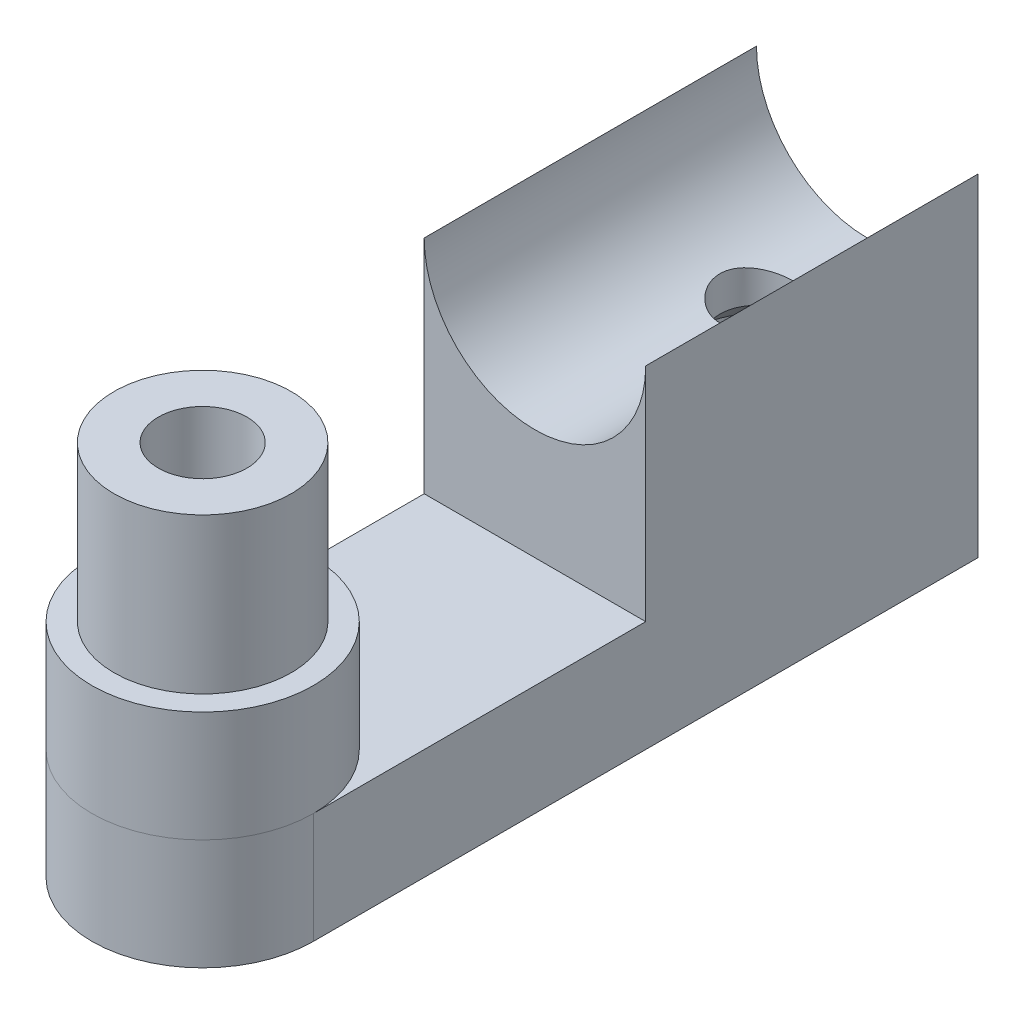
from build123d import *

# Parameters (mm, degrees)
SKETCH2_R           = 4
BOSS_EXTRUDE1_DEPTH = 7
SKETCH3_R           = 5
BOSS_EXTRUDE2_DEPTH = 5
SKETCH4_R           = 1.65
CUT_EXTRUDE1_DEPTH  = 12
SKETCH5_R           = 2
CUT_EXTRUDE2_DEPTH  = 5
BOSS_EXTRUDE3_DEPTH = 5
SKETCH8_W           = 10
SKETCH8_H           = 15
BOSS_EXTRUDE4_DEPTH = 10
CUT_EXTRUDE3_DEPTH  = 15
SKETCH10_R          = 2.75
CUT_EXTRUDE4_DEPTH  = 7.5
SKETCH11_R          = 1.65
CUT_EXTRUDE5_DEPTH  = 32.862987933
CHAMFER2_SIZE       = 1.2


with BuildPart() as part:
    # Sketch2 → Boss-Extrude1 (new body)
    with BuildSketch(Plane(origin=(0, 0, 0), x_dir=(1, 0, 0), z_dir=(0, 1, 0))):
        with Locations(Location((0, 0, 0), (0, 0, 270))):
            Circle(SKETCH2_R)
    extrude(amount=BOSS_EXTRUDE1_DEPTH)

    # Sketch3 → Boss-Extrude2 (add)
    with BuildSketch(Plane.XZ):
        with Locations(Location((0, 0, 0), (0, 0, 270))):
            Circle(SKETCH3_R)
    extrude(amount=BOSS_EXTRUDE2_DEPTH)

    # Sketch4 → Cut-Extrude1 (cut)
    with BuildSketch(Plane(origin=(0, 7, 0), x_dir=(1, 0, 0), z_dir=(0, 1, 0))):
        with Locations(Location((0, 0, 0), (0, 0, 270))):
            Circle(SKETCH4_R)
    extrude(amount=-CUT_EXTRUDE1_DEPTH, mode=Mode.SUBTRACT)

    # Sketch5 → Cut-Extrude2 (cut)
    with BuildSketch(Plane.XZ.offset(-7)):
        with Locations(Location((0, 0, 0), (0, 0, 270))):
            Circle(SKETCH5_R)
    extrude(amount=CUT_EXTRUDE2_DEPTH, mode=Mode.SUBTRACT)


with BuildPart() as body_2:
    # Sketch7 → Boss-Extrude3 (new body)
    with BuildSketch(Plane.XZ.offset(5)):
        with BuildLine():
            Line((-5, 0), (-5, -30))
            Line((-5, -30), (5, -30))
            Line((5, -30), (5, 0))
            ThreePointArc((5, 0), (0, 5), (-5, 0))
        make_face()
    extrude(amount=BOSS_EXTRUDE3_DEPTH)

    # Sketch8 → Boss-Extrude4 (add)
    with BuildSketch(Plane(origin=(0, -5, 0), x_dir=(1, 0, 0), z_dir=(0, 1, 0))):
        with Locations((0, 22.5)):
            Rectangle(SKETCH8_W, SKETCH8_H)
    extrude(amount=BOSS_EXTRUDE4_DEPTH)

    # Sketch9 → Cut-Extrude3 (cut)
    with BuildSketch(Plane(origin=(0, 0, -30), x_dir=(-1, 0, 0), z_dir=(0, 0, -1))):
        with BuildLine():
            Line((-5, 5), (5, 5))
            ThreePointArc((5, 5), (0, 0), (-5, 5))
        make_face()
    extrude(amount=-CUT_EXTRUDE3_DEPTH, mode=Mode.SUBTRACT)

    # Sketch10 → Cut-Extrude4 (cut)
    with BuildSketch(Plane.XZ.offset(10)):
        with Locations(Location((0, -25, 0), (0, 0, 270))):
            Circle(SKETCH10_R)
    extrude(amount=-CUT_EXTRUDE4_DEPTH, mode=Mode.SUBTRACT)

    # Sketch11 → Cut-Extrude5 (cut, through all)
    with BuildSketch(Plane.XZ.offset(2.5)):
        with Locations(Location((0, -25, 0), (0, 0, 270))):
            Circle(SKETCH11_R)
    extrude(amount=-CUT_EXTRUDE5_DEPTH, mode=Mode.SUBTRACT)

    # Chamfer2
    # the kernel refuses this chamfer: 1.2 mm, written as the material it takes off along each edge
    with BuildSketch(Plane(origin=(0, -2.5, -25), x_dir=(0, 0, -1), z_dir=(-1, 0, 0))) as chamfer2_piece_1_section:
        Polygon((1.65, -CHAMFER2_SIZE), (1.65 + CHAMFER2_SIZE, 0), (1.65, 0), align=None)
    chamfer2_piece_1 = revolve(axis=Axis((0, -2.5, -25), (0, -1, 0)), mode=Mode.PRIVATE)
    chamfer2_piece_1 = chamfer2_piece_1 & Plane(origin=(0, -1.848254626, -25), x_dir=(0, 0, -1), z_dir=(0, -1, 0)) * Cylinder(2.75, 12, mode=Mode.PRIVATE)
    add(chamfer2_piece_1, mode=Mode.SUBTRACT)


solid = Compound([part.part, body_2.part])
